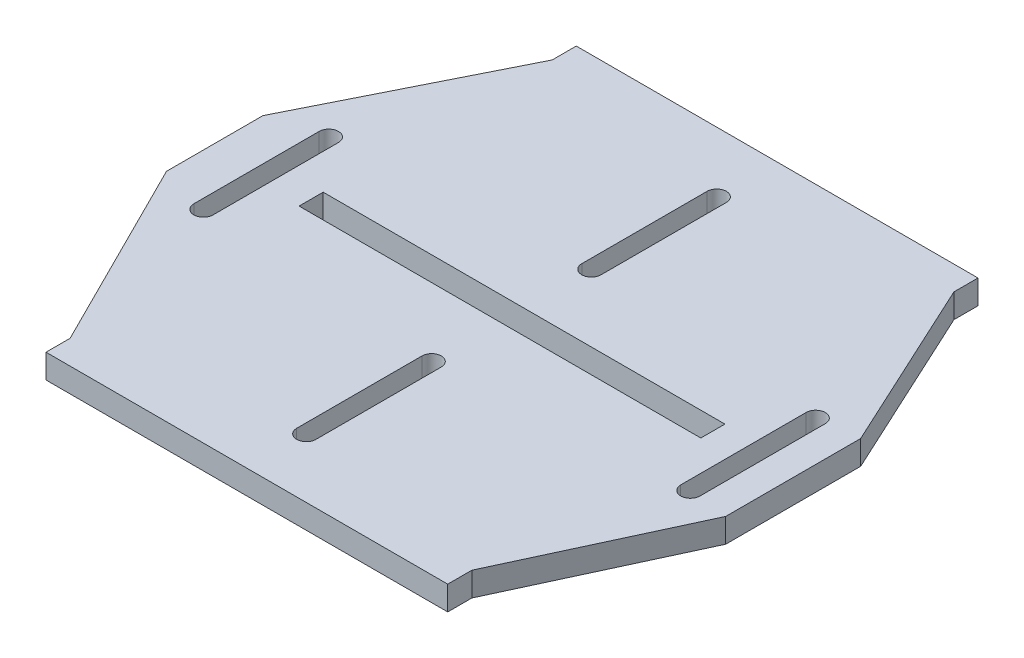
from build123d import *

# Parameters (mm, degrees)
SKETCH1_W           = 125
SKETCH1_H           = 7.5
BOSS_EXTRUDE6_DEPTH = 7.5


with BuildPart() as part:
    # Sketch1 → Boss-Extrude6 (new body)
    with BuildSketch(Plane(origin=(0, 0, 0), x_dir=(1, 0, 0), z_dir=(0, 1, 0))):
        Polygon((0, -7.5), (125, -7.5), (125, 0), (150, 54), (150, 96), (125, 150), (125, 157.5), (0, 157.5), (0, 150), (-30, 90), (-30, 60), (0, 0), align=None)
        with BuildLine():
            Line((134.5, 55.5), (134.5, 94.5))
            ThreePointArc((134.5, 94.5), (137.5, 97.5), (140.5, 94.5))
            Line((140.5, 94.5), (140.5, 55.5))
            ThreePointArc((140.5, 55.5), (137.5, 52.5), (134.5, 55.5))
        make_face(mode=Mode.SUBTRACT)
        with BuildLine():
            Line((-17, 55.5), (-17, 94.5))
            ThreePointArc((-17, 94.5), (-14, 97.5), (-11, 94.5))
            Line((-11, 94.5), (-11, 55.5))
            ThreePointArc((-11, 55.5), (-14, 52.5), (-17, 55.5))
        make_face(mode=Mode.SUBTRACT)
        with BuildLine():
            Line((59.5, 11), (59.5, 50))
            ThreePointArc((59.5, 50), (62.5, 53), (65.5, 50))
            Line((65.5, 50), (65.5, 11))
            ThreePointArc((65.5, 11), (62.5, 8), (59.5, 11))
        make_face(mode=Mode.SUBTRACT)
        with BuildLine():
            Line((65.5, 138.705746838), (65.5, 99.705746838))
            ThreePointArc((65.5, 99.705746838), (62.5, 96.705746838), (59.5, 99.705746838))
            Line((59.5, 99.705746838), (59.5, 138.705746838))
            ThreePointArc((59.5, 138.705746838), (62.5, 141.705746839), (65.5, 138.705746838))
        make_face(mode=Mode.SUBTRACT)
        with Locations((62.5, 75)):
            Rectangle(SKETCH1_W, SKETCH1_H, mode=Mode.SUBTRACT)
    extrude(amount=BOSS_EXTRUDE6_DEPTH)


solid = part.part
